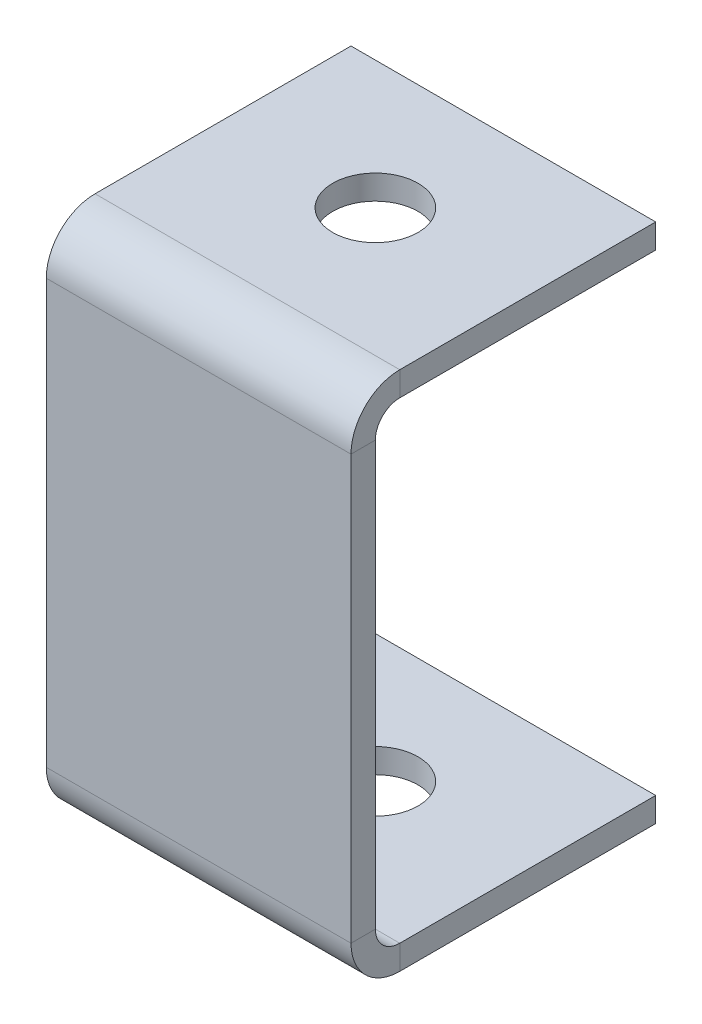
from build123d import *

# Parameters (mm, degrees)
SKETCH1_W                    = 25
SKETCH1_H                    = 42.75
BASE_FLANGE2_DEPTH           = 2
EDGE_FLANGE1_STRIP_W         = 12
EDGE_FLANGE1_STRIP_H         = 2
EDGE_FLANGE1_STRIP_CUT_DEPTH = 25
EDGE_FLANGE1_DEPTH           = 25
SKETCH14_R                   = 3.5
CUT_EXTRUDE2_DEPTH           = 50.41469923


# Sheet-metal steps are written as plain solids
with BuildPart() as part:
    # Sketch1 → Base-Flange2 (new body)
    with BuildSketch(Plane.XY):
        Rectangle(SKETCH1_W, SKETCH1_H)
    extrude(amount=-BASE_FLANGE2_DEPTH)

    # Edge-Flange1 strip (across the edge) → Edge-Flange1 strip cut (cut)
    with BuildSketch(Plane(origin=(12.5, -21.375, -2), x_dir=(0, 1, 0), z_dir=(-1, 0, 0))):
        with Locations((-2, -1)):
            Rectangle(EDGE_FLANGE1_STRIP_W, EDGE_FLANGE1_STRIP_H)
    edge_flange1_strip_cut = extrude(amount=EDGE_FLANGE1_STRIP_CUT_DEPTH, mode=Mode.SUBTRACT)

    # Edge-Flange1 section (across the edge) → Edge-Flange1 (add)
    with BuildSketch(Plane(origin=(12.5, -21.375, -2), x_dir=(0, 1, 0), z_dir=(-1, 0, 0))):
        with BuildLine():
            Line((0, 2), (0, 23))
            Line((0, 23), (2, 23))
            Line((2, 23), (2, 2))
            ThreePointArc((2, 2), (2.585786438, 0.585786438), (4, 0))
            Line((4, 0), (4, -2))
            ThreePointArc((4, -2), (1.171572875, -0.828427125), (0, 2))
        make_face()
    edge_flange1 = extrude(amount=EDGE_FLANGE1_DEPTH)

    # Sketch14 → Cut-Extrude2 (cut, through all)
    with BuildSketch(Plane(origin=(0, -19.375, 0), x_dir=(1, 0, 0), z_dir=(0, 1, 0))):
        with Locations(Location((0, 14.5, 0), (0, 0, 270))):
            Circle(SKETCH14_R)
    cut_extrude2 = extrude(amount=-CUT_EXTRUDE2_DEPTH, mode=Mode.SUBTRACT)

    # Mirror1: Edge-Flange1 strip cut, Edge-Flange1, Cut-Extrude2 across plane
    add(edge_flange1_strip_cut.mirror(Plane.ZX), mode=Mode.SUBTRACT)
    add(edge_flange1.mirror(Plane.ZX))
    add(cut_extrude2.mirror(Plane.ZX), mode=Mode.SUBTRACT)


solid = part.part
